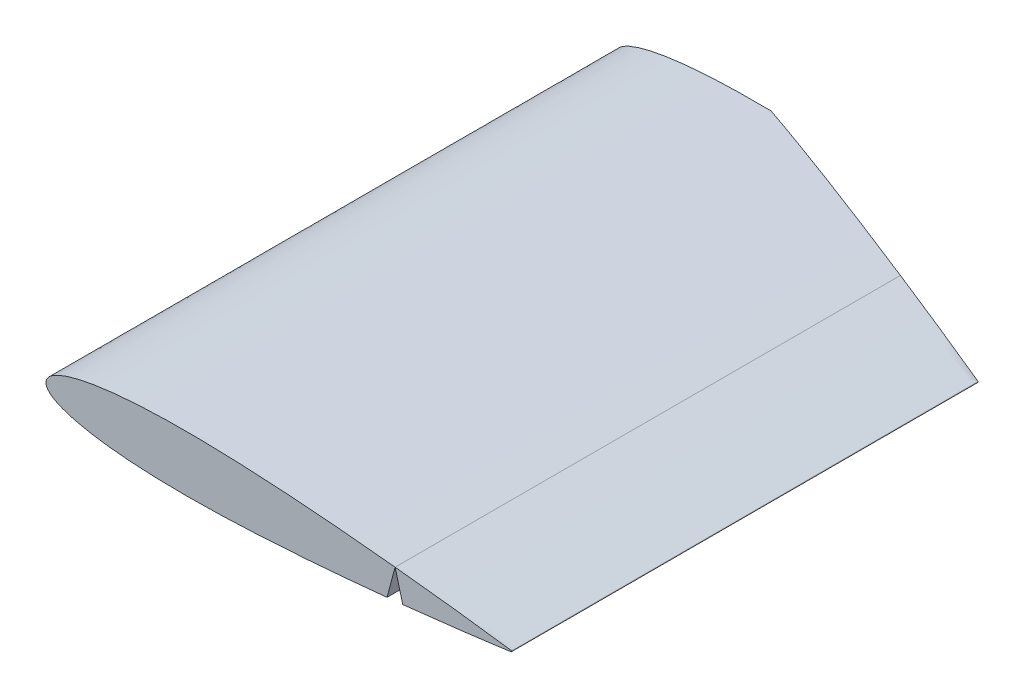
from build123d import *

# Parameters (mm, degrees)
BOSS_EXTRUDE1_DEPTH            = 279.908
SKETCH2_R                      = 6.35
CUT_EXTRUDE1_DEPTH             = 127
CUT_EXTRUDE2_REACH             = 363.655
CUT_EXTRUDE2_DIRECTION_2_REACH = 363.655
CUT_EXTRUDE4_REACH             = 363.655


with BuildPart() as part:
    # Sketch1 → Boss-Extrude1 (new body)
    with BuildSketch(Plane.XY):
        with BuildLine():
            add(Edge.make_bspline(
                [(0, 0), (0, -0.328477994), (0.094132544, -1.002317273), (0.516328799, -1.979047664), (1.206253084, -2.919084286), (2.155530292, -3.826507135), (3.361088978, -4.704503454), (4.821173785, -5.55391213), (6.533647864, -6.373768076), (8.495474965, -7.162212853), (10.702763054, -7.916899641), (13.150800968, -8.635300083), (15.834201004, -9.314707599), (18.746872001, -9.952655748), (21.882185807, -10.546523838), (25.23289446, -11.094151144), (28.791264659, -11.593290214), (32.549019843, -12.042255982), (36.4974269, -12.43944474), (40.627278951, -12.783751315), (44.928952977, -13.074379275), (49.392427762, -13.310840666), (54.00728167, -13.493188322), (58.76274015, -13.621763124), (63.647705329, -13.697267659), (68.650780173, -13.72087076), (73.760279514, -13.693983832), (78.964273059, -13.618365131), (84.250609651, -13.496063622), (89.606956912, -13.329404125), (95.020804226, -13.120820839), (100.479505937, -12.87299727), (105.970317865, -12.588746266), (111.480424999, -12.270931467), (116.996960654, -11.922505449), (122.507041698, -11.546430916), (127.997806048, -11.145660598), (133.456428211, -10.723198576), (138.870163217, -10.281871752), (144.226358514, -9.824563044), (149.512524459, -9.354044127), (154.7162998, -8.873020616), (159.825543847, -8.384191905), (164.828306858, -7.890045542), (169.712928008, -7.393148198), (174.467978148, -6.895915808), (179.082363681, -6.400793333), (183.545298009, -5.91018943), (187.846354056, -5.426302321), (191.975503597, -4.951590796), (195.923094736, -4.488262398), (199.679907253, -4.038593513), (203.237156328, -3.604799783), (206.586548753, -3.189155079), (209.720252989, -2.793754916), (212.630956022, -2.420810863), (215.311847817, -2.072241054), (217.75667572, -1.750168635), (219.959752272, -1.4563836), (221.915845594, -1.192545194), (223.620666071, -0.960790622), (225.069395854, -0.760875596), (226.261037983, -0.598983787), (227.186433997, -0.462932704), (227.858906671, -0.385743815), (228.245225393, -0.302214543), (228.641481893, -0.309763383), (228.641481893, 0.309763383), (228.245225393, 0.302214543), (227.858906671, 0.385743815), (227.186433997, 0.462932704), (226.261037983, 0.598983787), (225.069395854, 0.760875596), (223.620666071, 0.960790622), (221.915845594, 1.192545194), (219.959752272, 1.4563836), (217.75667572, 1.750168635), (215.311847817, 2.072241054), (212.630956022, 2.420810863), (209.720252989, 2.793754916), (206.586548753, 3.189155079), (203.237156328, 3.604799783), (199.679907253, 4.038593513), (195.923094736, 4.488262398), (191.975503597, 4.951590796), (187.846354056, 5.426302321), (183.545298009, 5.91018943), (179.082363681, 6.400793333), (174.467978148, 6.895915808), (169.712928008, 7.393148198), (164.828306858, 7.890045542), (159.825543847, 8.384191905), (154.7162998, 8.873020616), (149.512524459, 9.354044127), (144.226358514, 9.824563044), (138.870163217, 10.281871752), (133.456428211, 10.723198576), (127.997806048, 11.145660598), (122.507041698, 11.546430916), (116.996960654, 11.922505449), (111.480424999, 12.270931467), (105.970317865, 12.588746266), (100.479505937, 12.87299727), (95.020804226, 13.120820839), (89.606956912, 13.329404125), (84.250609651, 13.496063622), (78.964273059, 13.618365131), (73.760279514, 13.693983832), (68.650780173, 13.72087076), (63.647705329, 13.697267659), (58.76274015, 13.621763124), (54.00728167, 13.493188322), (49.392427762, 13.310840666), (44.928952977, 13.074379275), (40.627278951, 12.783751315), (36.4974269, 12.43944474), (32.549019843, 12.042255982), (28.791264659, 11.593290214), (25.23289446, 11.094151144), (21.882185807, 10.546523838), (18.746872001, 9.952655748), (15.834201004, 9.314707599), (13.150800968, 8.635300083), (10.702763054, 7.916899641), (8.495474965, 7.162212853), (6.533647864, 6.373768076), (4.821173785, 5.55391213), (3.361088978, 4.704503454), (2.155530292, 3.826507135), (1.206253084, 2.919084286), (0.516328799, 1.979047664), (0.094132544, 1.002317273), (0, 0.328477994), (0, 0)],
                knots=[0, 0, 0, 0, 0.002106168, 0.00432059, 0.006772783, 0.009556697, 0.012734041, 0.016342888, 0.020405604, 0.024934102, 0.029933071, 0.035402241, 0.04133743, 0.04773159, 0.054575389, 0.061857405, 0.069564571, 0.077682311, 0.086194684, 0.095084441, 0.104333244, 0.1139217, 0.123829339, 0.134034708, 0.144515531, 0.155248716, 0.166210356, 0.177375783, 0.188719821, 0.200216647, 0.211839951, 0.223562989, 0.235358653, 0.247199625, 0.259058395, 0.270907226, 0.282718457, 0.294464514, 0.306117689, 0.317650771, 0.329036618, 0.34024851, 0.351259999, 0.362045273, 0.372578891, 0.382836142, 0.392792739, 0.40242532, 0.411711115, 0.420628244, 0.429155673, 0.437273179, 0.444961561, 0.452202575, 0.458979063, 0.465274876, 0.471074963, 0.476365569, 0.481133961, 0.485368768, 0.489059784, 0.492198148, 0.494776266, 0.49678801, 0.498228425, 0.499094073, 0.499382862, 0.500617138, 0.500905927, 0.501771575, 0.50321199, 0.505223734, 0.507801852, 0.510940216, 0.514631232, 0.518866039, 0.523634431, 0.528925037, 0.534725124, 0.541020937, 0.547797425, 0.555038439, 0.562726821, 0.570844327, 0.579371756, 0.588288885, 0.59757468, 0.607207261, 0.617163858, 0.627421109, 0.637954727, 0.648740001, 0.65975149, 0.670963382, 0.682349229, 0.693882311, 0.705535486, 0.717281543, 0.729092774, 0.740941605, 0.752800375, 0.764641347, 0.776437011, 0.788160049, 0.799783353, 0.811280179, 0.822624217, 0.833789644, 0.844751284, 0.855484469, 0.865965292, 0.876170661, 0.8860783, 0.895666756, 0.904915559, 0.913805316, 0.922317689, 0.930435429, 0.938142595, 0.945424611, 0.95226841, 0.95866257, 0.964597759, 0.970066929, 0.975065898, 0.979594396, 0.983657112, 0.987265959, 0.990443303, 0.993227217, 0.99567941, 0.997893832, 1, 1, 1, 1], degree=3))
        make_face()
    extrude(amount=BOSS_EXTRUDE1_DEPTH)

    # Sketch2 → Cut-Extrude1 (cut)
    with BuildSketch(Plane(origin=(0, 0, 0), x_dir=(-1, 0, 0), z_dir=(0, 0, -1))):
        with Locations((-63.5, 0)):
            Circle(SKETCH2_R)
    extrude(amount=-CUT_EXTRUDE1_DEPTH, mode=Mode.SUBTRACT)

    # Sketch3 → Cut-Extrude2 (cut, up to next)
    with BuildSketch(Plane(origin=(0, 0, 0), x_dir=(1, 0, 0), z_dir=(0, 1, 0)), mode=Mode.PRIVATE) as cut_extrude2_sk1:
        Polygon((228.654985762, 0), (228.6, -50.8), (76.2, 0), align=None)
    cut_extrude2_tool1 = extrude(cut_extrude2_sk1.sketch, amount=-CUT_EXTRUDE2_REACH, mode=Mode.PRIVATE) & part.part
    add(cut_extrude2_tool1.solids().sort_by_distance((177.818329, 0, 16.933333))[0], mode=Mode.SUBTRACT)

    # Sketch3 → Cut-Extrude2 direction 2 (cut, up to next)
    with BuildSketch(Plane(origin=(0, 0, 0), x_dir=(1, 0, 0), z_dir=(0, 1, 0)), mode=Mode.PRIVATE) as cut_extrude2_direction_2_sk1:
        Polygon((228.654985762, 0), (228.6, -50.8), (76.2, 0), align=None)
    cut_extrude2_direction_2_tool1 = extrude(cut_extrude2_direction_2_sk1.sketch, amount=CUT_EXTRUDE2_DIRECTION_2_REACH, mode=Mode.PRIVATE) & part.part
    add(cut_extrude2_direction_2_tool1.solids().sort_by_distance((177.818329, 0, 16.933333))[0], mode=Mode.SUBTRACT)

    # Sketch4 → Cut-Extrude4 (cut, up to next)
    with BuildSketch(Plane.XY.offset(279.908), mode=Mode.PRIVATE) as cut_extrude4_sk1:
        with BuildLine():
            Line((171.45, 7.210810422), (167.476069754, -7.620099162))
            ThreePointArc((167.476069754, -7.620099162), (171.418734468, -7.953217945), (175.208259831, -6.815206213))
            Line((175.208259831, -6.815206213), (171.45, 7.210810422))
        make_face()
    cut_extrude4_tool1 = extrude(cut_extrude4_sk1.sketch, amount=-CUT_EXTRUDE4_REACH, mode=Mode.PRIVATE) & part.part
    add(cut_extrude4_tool1.solids().sort_by_distance((171.377772, -2.738805, 279.908))[0], mode=Mode.SUBTRACT)


with BuildPart() as cut_extrude4_piece_1:
    # of the separate pieces the step leaves, piece 1, a body of its own (cut_extrude4_pieces)
    add(part.part.solids().sort_by_distance((0, 0, 0))[0])


with BuildPart() as cut_extrude4_piece_2:
    # of the separate pieces the step leaves, piece 2, a body of its own (cut_extrude4_pieces)
    add(part.part.solids().sort_by_distance((175.208259831, -6.815206213, 279.908))[0])


solid = Compound([cut_extrude4_piece_1.part, cut_extrude4_piece_2.part])
